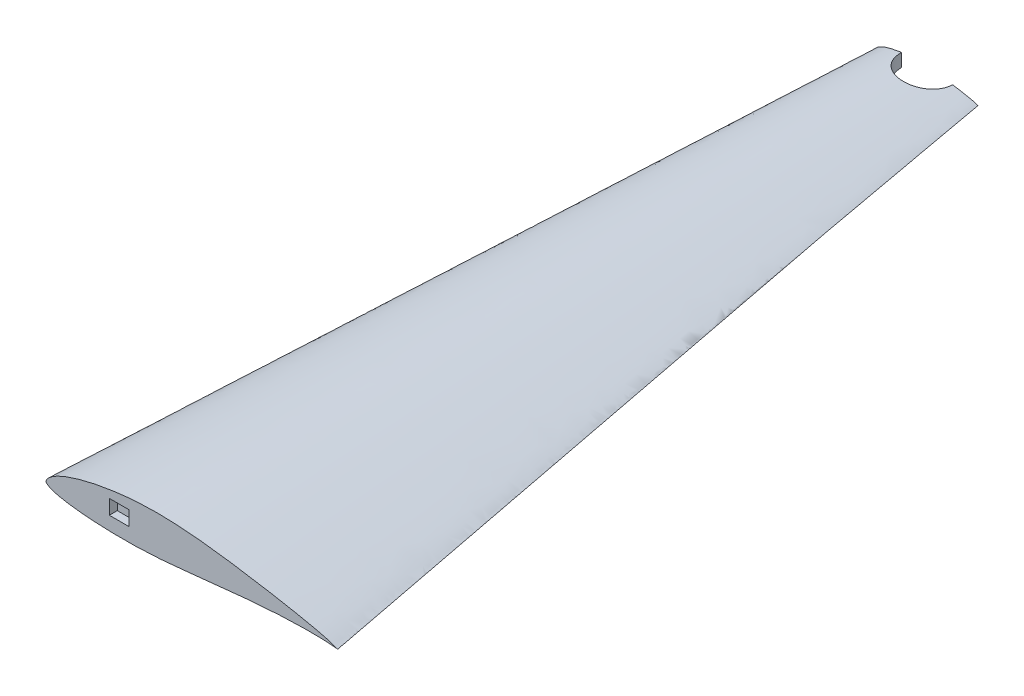
from build123d import *

# Parameters (mm, degrees)
SKETCH9_W           = 153.025181843
SKETCH9_H           = 114.223926853
BOSS_EXTRUDE1_DEPTH = 30
SKETCH10_W          = 3736.04637994
SKETCH10_H          = 1750.840031194
CUT_EXTRUDE1_DEPTH  = 6202
SKETCH12_W          = 153.025181843
SKETCH12_H          = 114.223926853
CUT_EXTRUDE2_DEPTH  = 120
SKETCH13_R          = 200
CUT_EXTRUDE3_DEPTH  = 17000


with BuildPart() as part:
    # Loft5: read off the stored shape, not the designer's step
    # Loft5: loft between two sections, ruled curve by curve
    loft5_from = [
        Edge.make_bspline([(-829.212772497, 127.551706357, 0), (-831.317274891, 127.061718607, 0), (-844.668148264, 123.928740686, 0), (-872.329771939, 117.109052219, 0), (-906.646678697, 107.793584513, 0), (-943.80675307, 96.706282111, 0), (-972.975630231, 87.133596036, 0), (-1007.056661139, 74.800467806, 0), (-1030.665167222, 65.371687304, 0), (-1061.251311385, 51.696229701, 0), (-1079.007221144, 42.808632271, 0), (-1104.056348403, 28.406825452, 0), (-1117.409319776, 19.763642688, 0), (-1135.661709212, 5.372212741, 0), (-1144.515334401, -2.76604107, 0), (-1152.824664261, -12.775534115, 0), (-1156.436856109, -17.898520897, 0), (-1159.789487128, -23.909048657, 0), (-1161.961165575, -29.098752305, 0), (-1162.898772566, -33.888692217, 0), (-1162.722322656, -37.246430416, 0), (-1161.376410185, -40.405163539, 0), (-1159.101061336, -43.341445224, 0), (-1156.169648214, -46.360268456, 0), (-1153.913610018, -48.325076325, 0), (-1149.037863286, -52.229824068, 0), (-1144.904465379, -54.873739693, 0), (-1138.918168667, -58.2614101, 0), (-1135.409125373, -60.114894418, 0), (-1131.086153496, -62.184117695, 0), (-1128.062749348, -63.552116154, 0), (-1124.957966743, -64.902605897, 0), (-1121.733410812, -66.233544346, 0), (-1117.820438188, -67.774740949, 0), (-1110.816309962, -70.417875078, 0), (-1097.913469259, -74.794649303, 0), (-1085.242602625, -78.392314228, 0), (-1064.043847197, -83.894313067, 0), (-1047.315496568, -87.539615236, 0), (-1017.117187521, -93.260495205, 0), (-994.512717815, -96.924455589, 0), (-959.517300941, -101.820414141, 0), (-930.120025114, -105.403442174, 0), (-891.724704525, -109.432084325, 0), (-856.001094532, -112.660371668, 0), (-814.532681306, -115.819272508, 0), (-773.108617956, -118.46019236, 0), (-728.921749645, -120.727861062, 0), (-682.487865336, -122.589459116, 0), (-635.955138153, -123.896306526, 0), (-585.260805311, -124.716877102, 0), (-536.786168999, -124.870489109, 0), (-482.492900731, -124.307536975, 0), (-432.360602341, -123.075537446, 0), (-374.939789857, -120.848489139, 0), (-323.370046071, -118.090444143, 0), (-263.150854917, -113.99486438, 0), (-210.284693563, -109.672068592, 0), (-147.384354845, -103.796961064, 0), (-93.209248624, -98.245085126, 0), (-27.830451447, -91.283325291, 0), (27.454015847, -85.244242969, 0), (94.536215974, -77.893849451, 0), (150.39908442, -71.81267181, 0), (218.052527081, -64.624948902, 0), (273.920887846, -58.869058971, 0), (340.938588876, -52.252940051, 0), (396.199038728, -47.078911228, 0), (461.320625474, -41.411227612, 0), (515.337224218, -37.086128159, 0), (577.258841301, -32.619053172, 0), (629.366984439, -29.282013497, 0), (686.772059362, -26.121169414, 0), (736.32883914, -23.863508643, 0), (788.002218715, -22.08100638, 0), (834.381396591, -20.969016588, 0), (878.996349976, -20.394696271, 0), (921.647415287, -20.369424901, 0), (958.504069283, -20.876496332, 0), (996.654106057, -21.799806632, 0), (1023.598056722, -22.716367439, 0), (1057.024719476, -24.623742059, 0), (1077.499981305, -26.264632795, 0), (1096.514340268, -27.566782518, 0), (1105.67791724, -28.280245159, 0), (1126.629467928, -31.787482376, 0), (1116.860258711, -29.204675117, 0), (1103.491455609, -25.345372413, 0), (1097.045245428, -22.784584734, 0), (1087.42865464, -19.254695703, 0), (1081.046641164, -16.983065882, 0), (1071.065638587, -13.548629979, 0), (1060.508198045, -10.056396018, 0), (1041.501846956, -4.011755255, 0), (1027.267729689, 0.144425406, 0), (1001.62865514, 7.087391456, 0), (982.966051304, 11.664428987, 0), (950.144604936, 19.245814605, 0), (924.339173662, 24.953084517, 0), (887.987857285, 32.691699437, 0), (855.221667661, 39.456253619, 0), (815.432732419, 47.436061284, 0), (776.394699371, 55.078042811, 0), (733.635824341, 63.242248164, 0), (689.09132049, 71.554958692, 0), (643.736426124, 79.820771828, 0), (594.501021823, 88.597113467, 0), (546.979513719, 96.853397495, 0), (493.926468036, 105.814553336, 0), (444.688425496, 113.877854678, 0), (388.704102795, 122.751431019, 0), (338.176625069, 130.462695339, 0), (280.153653465, 138.938776244, 0), (228.796399932, 146.066997244, 0), (169.620247767, 153.793957674, 0), (117.8495197, 160.094803785, 0), (58.371499933, 166.752946042, 0), (6.613894095, 171.982487207, 0), (-52.350409868, 177.19161356, 0), (-103.707599495, 180.989927105, 0), (-161.504174793, 184.272167029, 0), (-212.18503492, 186.250098279, 0), (-268.376964457, 187.366353469, 0), (-318.189108737, 187.369099053, 0), (-372.466520975, 186.211013679, 0), (-421.229723555, 184.136770997, 0), (-473.348885587, 180.784630174, 0), (-520.928345689, 176.749110039, 0), (-570.605287005, 171.553982266, 0), (-616.78200539, 165.855506715, 0), (-663.514068565, 159.219359753, 0), (-707.942171735, 152.063883731, 0), (-751.094306198, 144.229303286, 0), (-791.304100998, 136.103996798, 0), (-816.926871374, 130.412212037, 0), (-829.212772497, 127.551706357, 0)], [0, 0, 0, 0, 0.001389313, 0.008817328, 0.018317328, 0.024249235, 0.033749235, 0.038050758, 0.047550758, 0.050086992, 0.059586992, 0.060298396, 0.068662508, 0.069798396, 0.075196821, 0.076355027, 0.078162508, 0.079210607, 0.080771243, 0.081759988, 0.082324933, 0.082903368, 0.083935007, 0.084696821, 0.08560475, 0.085855027, 0.088710607, 0.088745281, 0.090271243, 0.091259988, 0.091824933, 0.092403368, 0.093435007, 0.094065408, 0.09510475, 0.098245281, 0.102821682, 0.103565408, 0.112321682, 0.113824926, 0.123324926, 0.127043205, 0.136543205, 0.142365824, 0.151865824, 0.159606169, 0.169106169, 0.178554979, 0.188054979, 0.198986583, 0.208486583, 0.220654823, 0.230154823, 0.243397979, 0.252897979, 0.267102846, 0.276602846, 0.291707475, 0.301207475, 0.317224202, 0.326724202, 0.343484356, 0.352984356, 0.370117039, 0.379617039, 0.3967311, 0.4062311, 0.422919301, 0.432419301, 0.448263223, 0.457763223, 0.472337171, 0.481837171, 0.494734876, 0.504234876, 0.515067169, 0.524567169, 0.532973464, 0.542473464, 0.548115275, 0.557615275, 0.560239006, 0.569117917, 0.569739006, 0.574561052, 0.5764, 0.578180254, 0.578617917, 0.583176619, 0.584061052, 0.5859, 0.587680254, 0.590707632, 0.592676619, 0.600207632, 0.600446247, 0.609946247, 0.612516403, 0.622016403, 0.626946973, 0.636446973, 0.643529884, 0.653029884, 0.662024429, 0.671524429, 0.682167292, 0.691667292, 0.703682098, 0.713182098, 0.726264114, 0.735764114, 0.74962976, 0.75912976, 0.773469078, 0.782969078, 0.797503034, 0.807003034, 0.821451957, 0.830951957, 0.84506318, 0.85456318, 0.868172798, 0.877672798, 0.890698508, 0.900198508, 0.912577511, 0.922077511, 0.933777359, 0.943277359, 0.95419167, 0.96369167, 0.973624888, 0.983124888, 0.991889313, 1, 1, 1, 1], 3),
    ]
    loft5_to = [
        Edge.make_bspline([(-729.582389456, 13.403805311, 6200), (-730.318211722, 13.238348565, 6200), (-734.98649761, 12.180942787, 6200), (-744.66247192, 9.886964265, 6200), (-756.675221699, 6.770524912, 6200), (-769.701597857, 3.093513865, 6200), (-779.941039136, -0.05877316, 6200), (-791.937939175, -4.073504277, 6200), (-800.271635923, -7.114097709, 6200), (-811.137073166, -11.433971487, 6200), (-817.485959529, -14.19456714, 6200), (-826.581899049, -18.557067843, 6200), (-831.501072742, -21.127209764, 6200), (-838.462484808, -25.246287729, 6200), (-841.975859972, -27.509371787, 6200), (-845.654984774, -30.176591122, 6200), (-847.387479055, -31.504072044, 6200), (-849.254612158, -33.019459167, 6200), (-850.738397936, -34.299081324, 6200), (-851.981208618, -35.450593648, 6200), (-852.81195744, -36.258654397, 6200), (-853.643168007, -37.098398304, 6200), (-854.522834035, -38.038824986, 6200), (-855.486598587, -39.143425162, 6200), (-856.144369435, -39.951804386, 6200), (-857.470291301, -41.682556994, 6200), (-858.399044101, -43.126554736, 6200), (-859.437447764, -45.292435097, 6200), (-859.951652512, -46.585094986, 6200), (-860.250483794, -48.243008279, 6200), (-860.171358916, -49.413931298, 6200), (-859.685133378, -50.509291448, 6200), (-858.920544702, -51.46604271, 6200), (-857.890282721, -52.51274062, 6200), (-855.899412614, -54.210877329, 6200), (-851.845410917, -56.738617721, 6200), (-847.631826927, -58.591481927, 6200), (-840.476286073, -61.294767411, 6200), (-834.724461756, -62.945601924, 6200), (-824.291101711, -65.451606173, 6200), (-816.441328873, -66.973721147, 6200), (-804.264962227, -68.934536156, 6200), (-794.016105144, -70.292979192, 6200), (-780.624231997, -71.788910349, 6200), (-768.15823144, -72.952015434, 6200), (-753.685229768, -74.065867066, 6200), (-739.225029965, -74.968204536, 6200), (-723.800256947, -75.720503999, 6200), (-707.59066002, -76.309738655, 6200), (-691.347393324, -76.703765359, 6200), (-673.652310294, -76.920958508, 6200), (-656.732725681, -76.915239558, 6200), (-637.783141412, -76.660005077, 6200), (-620.28657042, -76.175627428, 6200), (-600.247094685, -75.335952801, 6200), (-582.250512499, -74.314957468, 6200), (-561.236484634, -72.814658427, 6200), (-542.791640178, -71.218916422, 6200), (-520.849100672, -69.035328801, 6200), (-501.958483833, -66.92672383, 6200), (-479.169318703, -64.222617868, 6200), (-459.902845381, -61.856842079, 6200), (-436.529026608, -58.946691598, 6200), (-417.066692699, -56.516875483, 6200), (-393.498661069, -53.611404802, 6200), (-374.03645908, -51.263140683, 6200), (-350.690306424, -48.532951986, 6200), (-331.439751589, -46.363488637, 6200), (-308.753293046, -43.93747608, 6200), (-289.934159161, -42.045489335, 6200), (-268.359116036, -40.035462323, 6200), (-250.199918116, -38.480736838, 6200), (-230.190766005, -36.936212469, 6200), (-212.91889373, -35.747522114, 6200), (-194.910643233, -34.687055333, 6200), (-178.727987445, -33.896785804, 6200), (-163.142037505, -33.300869727, 6200), (-148.295180486, -32.878505974, 6200), (-135.510280925, -32.668243988, 6200), (-122.064312898, -32.610547727, 6200), (-112.41237929, -32.676095179, 6200), (-101.185621164, -32.839242744, 6200), (-94.694191826, -33.009619549, 6200), (-86.646997526, -33.381934733, 6200), (-82.437547294, -33.623039531, 6200), (-77.887637836, -33.892326878, 6200), (-75.836489586, -34.010750741, 6200), (-72.598003768, -34.189053211, 6200), (-70.178258635, -34.301668596, 6200), (-65.130926277, -34.952280468, 6200), (-61.219968316, -35.546922275, 6200), (-66.827943541, -34.153745823, 6200), (-70.308987126, -33.04414093, 6200), (-75.598263023, -31.116558633, 6200), (-81.045792296, -29.345647125, 6200), (-90.319570234, -26.507163426, 6200), (-96.595904047, -24.750384373, 6200), (-107.88502428, -21.957778239, 6200), (-116.957770808, -19.954032435, 6200), (-129.689332313, -17.290409799, 6200), (-141.121593196, -15.011777611, 6200), (-155.022712636, -12.343362224, 6200), (-168.679885661, -9.806925635, 6200), (-183.635091475, -7.108962462, 6200), (-199.211125486, -4.374114881, 6200), (-215.071766812, -1.663516138, 6200), (-232.290856731, 1.205102467, 6200), (-248.908737025, 3.903029265, 6200), (-267.458845846, 6.830098193, 6200), (-284.67394302, 9.459710916, 6200), (-304.246471706, 12.348521858, 6200), (-321.909051, 14.859760629, 6200), (-342.189067406, 17.620147222, 6200), (-360.136717598, 19.943970403, 6200), (-380.81354783, 22.464574829, 6200), (-398.900387153, 24.520166576, 6200), (-419.676785549, 26.691326162, 6200), (-437.753077169, 28.405097583, 6200), (-458.342023145, 30.120547388, 6200), (-476.271878737, 31.390704448, 6200), (-496.445788386, 32.511818091, 6200), (-514.135464419, 33.198221005, 6200), (-533.747761807, 33.602932118, 6200), (-551.134229476, 33.637210802, 6200), (-570.079752186, 33.291176346, 6200), (-587.102435635, 32.626327338, 6200), (-605.298537547, 31.527055863, 6200), (-621.909929147, 30.172193525, 6200), (-639.254057596, 28.403654796, 6200), (-655.375965402, 26.451894064, 6200), (-671.691690803, 24.168932191, 6200), (-687.207071999, 21.722041351, 6200), (-702.280533154, 19.055363782, 6200), (-716.330842904, 16.297550032, 6200), (-725.286723349, 14.369727336, 6200), (-729.582389456, 13.403805311, 6200)], [0, 0, 0, 0, 0.001389313, 0.008817328, 0.018317328, 0.024249235, 0.033749235, 0.038050758, 0.047550758, 0.050086992, 0.059586992, 0.060298396, 0.068662508, 0.069798396, 0.075196821, 0.076355027, 0.078162508, 0.079210607, 0.080771243, 0.081759988, 0.082324933, 0.082903368, 0.083935007, 0.084696821, 0.08560475, 0.085855027, 0.088710607, 0.088745281, 0.090271243, 0.091259988, 0.091824933, 0.092403368, 0.093435007, 0.094065408, 0.09510475, 0.098245281, 0.102821682, 0.103565408, 0.112321682, 0.113824926, 0.123324926, 0.127043205, 0.136543205, 0.142365824, 0.151865824, 0.159606169, 0.169106169, 0.178554979, 0.188054979, 0.198986583, 0.208486583, 0.220654823, 0.230154823, 0.243397979, 0.252897979, 0.267102846, 0.276602846, 0.291707475, 0.301207475, 0.317224202, 0.326724202, 0.343484356, 0.352984356, 0.370117039, 0.379617039, 0.3967311, 0.4062311, 0.422919301, 0.432419301, 0.448263223, 0.457763223, 0.472337171, 0.481837171, 0.494734876, 0.504234876, 0.515067169, 0.524567169, 0.532973464, 0.542473464, 0.548115275, 0.557615275, 0.560239006, 0.569117917, 0.569739006, 0.574561052, 0.5764, 0.578180254, 0.578617917, 0.583176619, 0.584061052, 0.5859, 0.587680254, 0.590707632, 0.592676619, 0.600207632, 0.600446247, 0.609946247, 0.612516403, 0.622016403, 0.626946973, 0.636446973, 0.643529884, 0.653029884, 0.662024429, 0.671524429, 0.682167292, 0.691667292, 0.703682098, 0.713182098, 0.726264114, 0.735764114, 0.74962976, 0.75912976, 0.773469078, 0.782969078, 0.797503034, 0.807003034, 0.821451957, 0.830951957, 0.84506318, 0.85456318, 0.868172798, 0.877672798, 0.890698508, 0.900198508, 0.912577511, 0.922077511, 0.933777359, 0.943277359, 0.95419167, 0.96369167, 0.973624888, 0.983124888, 0.991889313, 1, 1, 1, 1], 3),
    ]
    loft5 = Solid(Shell([*[Face.make_surface_from_curves(loft5_from[k], loft5_to[k]) for k in range(1)], Face(Wire(loft5_from)), Face(Wire(loft5_to))]))
    add(loft5)

    # Sketch9 → Boss-Extrude1 (add)
    with BuildSketch(Plane(origin=(0, 0, 0), x_dir=(-1, 0, 0), z_dir=(0, 0, -1))):
        with Locations((590.106894295, 40.833916784)):
            Rectangle(SKETCH9_W, SKETCH9_H)
    extrude(amount=BOSS_EXTRUDE1_DEPTH)

    # Mirror3: part across plane


with BuildPart() as part_1:
    add(part.part)
    add(part.part.mirror(Plane(origin=(0, 0, -30), x_dir=(1, 0, 0), z_dir=(0, 0, -1))))

    # Sketch10 → Cut-Extrude1 (cut)
    with BuildSketch(Plane.XY.offset(6200)):
        with Locations((-546.741461091, 0)):
            Rectangle(SKETCH10_W, SKETCH10_H)
    extrude(amount=-CUT_EXTRUDE1_DEPTH, mode=Mode.SUBTRACT)

    # Sketch12 → Cut-Extrude2 (cut)
    with BuildSketch(Plane.XY.offset(-2)):
        with Locations((-590.106894295, 40.833916784)):
            Rectangle(SKETCH12_W, SKETCH12_H)
    extrude(amount=-CUT_EXTRUDE2_DEPTH, mode=Mode.SUBTRACT)

    # Sketch13 → Cut-Extrude3 (cut)
    with BuildSketch(Plane(origin=(-2172.474712708, -6356.51367508, -7432.816109292), x_dir=(1, 0, 0), z_dir=(0, 1, 0))):
        with Locations((1710.986148181, -1172.816109292)):
            Circle(SKETCH13_R)
    extrude(amount=CUT_EXTRUDE3_DEPTH, mode=Mode.SUBTRACT)


solid = part_1.part
